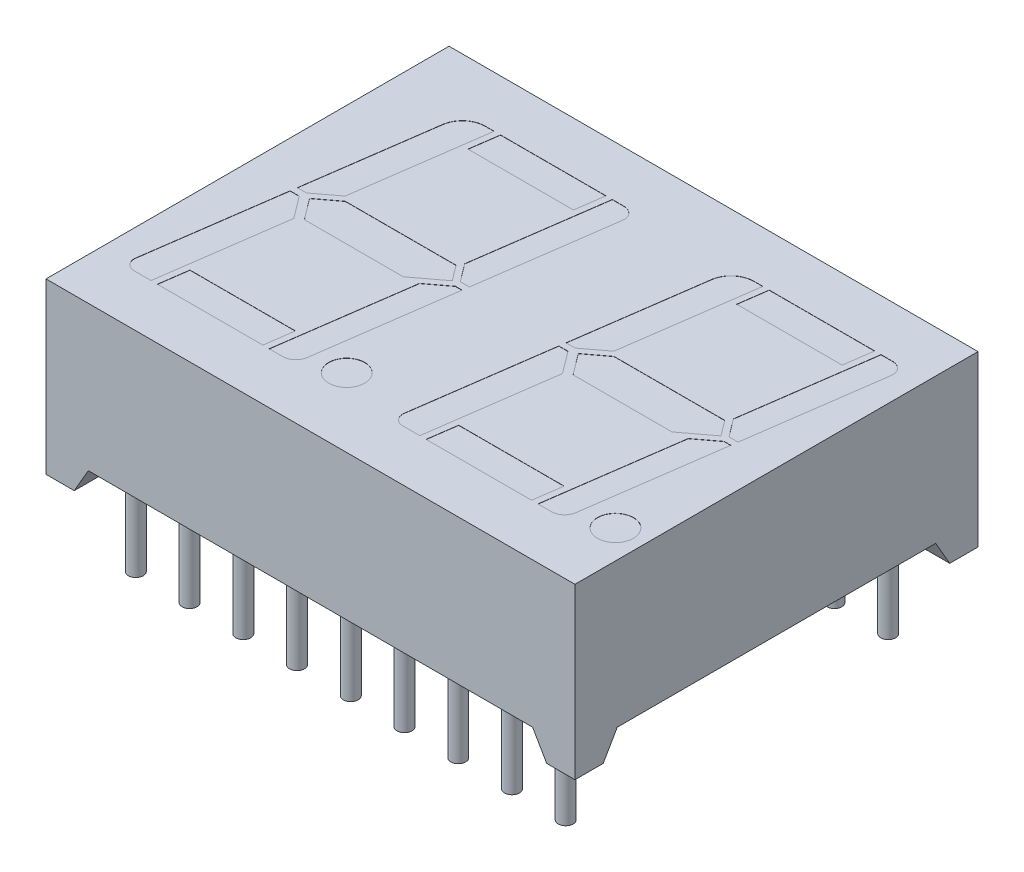
from build123d import *

# Parameters (mm, degrees)
SKETCH1_W           = 25
SKETCH1_H           = 19.05
BOSS_EXTRUDE1_DEPTH = 8
CUT_EXTRUDE1_DEPTH  = 25.148550681
SKETCH3_R           = 0.85
CUT_EXTRUDE3_DEPTH  = 0.01
LPATTERN2_COUNT     = 2
LPATTERN2_PITCH     = 12.7
CUT_EXTRUDE4_DEPTH  = 28.923567555
SKETCH5_R           = 0.350894015
BOSS_EXTRUDE2_DEPTH = 4.91


with BuildPart() as part:
    # Sketch1 → Boss-Extrude1 (new body)
    with BuildSketch(Plane(origin=(0, 0, 0), x_dir=(1, 0, 0), z_dir=(0, 1, 0))):
        Rectangle(SKETCH1_W, SKETCH1_H)
    extrude(amount=BOSS_EXTRUDE1_DEPTH)

    # Sketch2 → Cut-Extrude1 (cut, through all)
    with BuildSketch(Plane.XY.offset(9.525)):
        Polygon((-41.143597774, -51.926268272), (-11.16395281, 0), (-10.5, 1.15), (10.5, 1.15), (11.16395281, 0), (41.143597774, -51.926268272), (41.143597774, -171.844848132), (-41.143597774, -171.844848132), align=None)
    extrude(amount=-CUT_EXTRUDE1_DEPTH, mode=Mode.SUBTRACT)

    # Sketch3 → Cut-Extrude3 (cut)
    with BuildSketch(Plane(origin=(0, 8, 0), x_dir=(1, 0, 0), z_dir=(0, 1, 0))):
        with Locations((-1.55, -6.26)):
            Circle(SKETCH3_R)
        with BuildLine():
            Line((-10.293918875, 0.15), (-9.446582946, 6.179108414))
            ThreePointArc((-9.446582946, 6.179108414), (-9.085171861, 6.844744827), (-8.375714675, 7.11))
            Line((-8.375714675, 7.11), (-7.952487442, 7.11))
            Line((-7.952487442, 7.11), (-8.820313991, 0.935093249))
            Line((-8.820313991, 0.935093249), (-9.862167922, 0.15))
            Line((-9.862167922, 0.15), (-10.293918875, 0.15))
        make_face()
        with BuildLine():
            Line((-2.367186588, 7.11), (-1.813478843, 7.11))
            ThreePointArc((-1.813478843, 7.11), (-1.401654728, 6.922320938), (-1.273116986, 6.488384791))
            Line((-1.273116986, 6.488384791), (-2.163918875, 0.15))
            Line((-2.163918875, 0.15), (-2.593918875, 0.15))
            Line((-2.593918875, 0.15), (-3.227234844, 0.990438678))
            Line((-3.227234844, 0.990438678), (-2.367186588, 7.11))
        make_face()
        Polygon((-7.652487442, 7.11), (-2.667186588, 7.11), (-2.856916715, 5.76), (-7.842217569, 5.76), align=None)
        Polygon((-8.604632176, 0.726571417), (-3.369972607, 0.726571417), (-2.822461773, 0), (-4.142522346, -0.994736992), (-8.819236923, -0.994736992), (-9.568825012, 0), align=None)
        with BuildLine():
            Line((-10.336081125, -0.15), (-9.904330172, -0.15))
            Line((-9.904330172, -0.15), (-9.119236923, -1.191853931))
            Line((-9.119236923, -1.191853931), (-9.950978112, -7.11))
            Line((-9.950978112, -7.11), (-10.750461652, -7.11))
            ThreePointArc((-10.750461652, -7.11), (-11.120337027, -6.94143808), (-11.235781811, -6.551703021))
            Line((-11.235781811, -6.551703021), (-10.336081125, -0.15))
        make_face()
        Polygon((-9.650978112, -7.11), (-4.665677257, -7.11), (-4.47594713, -5.76), (-9.461247985, -5.76), align=None)
        with BuildLine():
            Line((-2.206081125, -0.15), (-3.108270084, -6.569408002))
            ThreePointArc((-3.108270084, -6.569408002), (-3.318150529, -6.955959695), (-3.730150039, -7.11))
            Line((-3.730150039, -7.11), (-4.365677257, -7.11))
            Line((-4.365677257, -7.11), (-3.489911075, -0.878599823))
            Line((-3.489911075, -0.878599823), (-2.523026453, -0.15))
            Line((-2.523026453, -0.15), (-2.206081125, -0.15))
        make_face()
    cut_extrude3 = extrude(amount=-CUT_EXTRUDE3_DEPTH, mode=Mode.SUBTRACT)

    # LPattern2: Cut-Extrude3 ×2
    with Locations(*[(i * LPATTERN2_PITCH, 0, 0) for i in range(1, LPATTERN2_COUNT)]):
        add(cut_extrude3, mode=Mode.SUBTRACT)

    # Sketch4 → Cut-Extrude4 (cut, through all)
    with BuildSketch(Plane.ZY.offset(12.5)):
        Polygon((-32.625622384, -42.32555327), (-8.18895281, 0), (-7.525, 1.15), (7.525, 1.15), (8.18895281, 0), (32.625622384, -42.32555327), (32.625622384, -140.072231568), (-32.625622384, -140.072231568), align=None)
    extrude(amount=-CUT_EXTRUDE4_DEPTH, mode=Mode.SUBTRACT)

    # Sketch5 → Boss-Extrude2 (add)
    with BuildSketch(Plane.XZ.offset(-1.15)):
        with Locations((0, 7.62)):
            Circle(SKETCH5_R)
        with Locations((-2.54, 7.62)):
            Circle(SKETCH5_R)
        with Locations((-5.08, 7.62)):
            Circle(SKETCH5_R)
        with Locations((-7.62, 7.62)):
            Circle(SKETCH5_R)
        with Locations((-10.16, 7.62)):
            Circle(SKETCH5_R)
        with Locations((2.54, 7.62)):
            Circle(SKETCH5_R)
        with Locations((5.08, 7.62)):
            Circle(SKETCH5_R)
        with Locations((7.62, 7.62)):
            Circle(SKETCH5_R)
        with Locations((10.16, 7.62)):
            Circle(SKETCH5_R)
        with Locations((10.16, -7.62)):
            Circle(SKETCH5_R)
        with Locations((7.62, -7.62)):
            Circle(SKETCH5_R)
        with Locations((5.08, -7.62)):
            Circle(SKETCH5_R)
        with Locations((2.54, -7.62)):
            Circle(SKETCH5_R)
        with Locations((-10.16, -7.62)):
            Circle(SKETCH5_R)
        with Locations((-7.62, -7.62)):
            Circle(SKETCH5_R)
        with Locations((-5.08, -7.62)):
            Circle(SKETCH5_R)
        with Locations((-2.54, -7.62)):
            Circle(SKETCH5_R)
        with Locations((0, -7.62)):
            Circle(SKETCH5_R)
    extrude(amount=BOSS_EXTRUDE2_DEPTH)


solid = part.part
